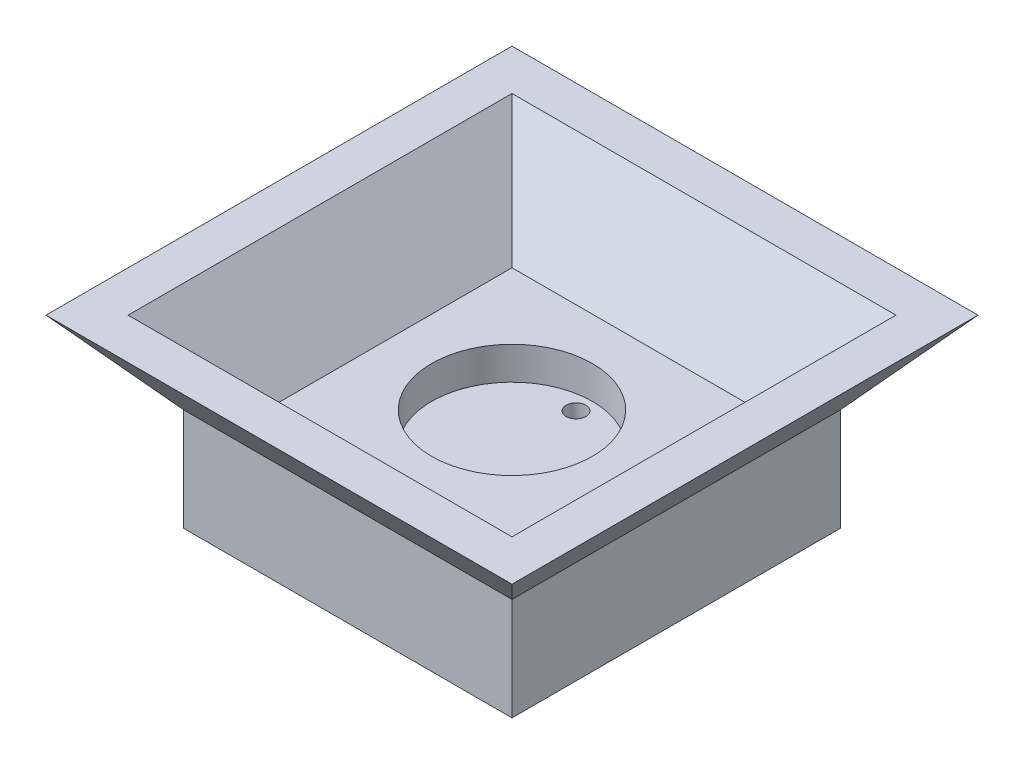
from build123d import *

# Parameters (mm, degrees)
SKETCH1_W               = 50.8
SKETCH1_H               = 50.8
BOSS_EXTRUDE1_DEPTH     = 15.875
SKETCH2_W               = 50.8
SKETCH2_H               = 50.8
BOSS_EXTRUDE2_DEPTH     = 12.7
BOSS_EXTRUDE2_DRAFT     = -40
MIRROR1_COPY_1_SKETCH_W = 50.8
MIRROR1_COPY_1_SKETCH_H = 50.8
MIRROR1_COPY_1_DEPTH    = 12.7
MIRROR1_COPY_1_DRAFT    = -40
SKETCH4_W               = 59.413130632
SKETCH4_H               = 59.413130632
CUT_EXTRUDE2_DEPTH      = 12.7
CUT_EXTRUDE2_DRAFT      = -40
SKETCH5_R               = 12.446
CUT_EXTRUDE3_DEPTH      = 5.08
SKETCH6_R               = 1.524
CUT_EXTRUDE4_DEPTH      = 20.32
CUT_EXTRUDE5_REACH      = 60.452
SKETCH8_W               = 110.353971767
SKETCH8_H               = 106.914185114


with BuildPart() as part:
    # Sketch1 → Boss-Extrude1 (new, symmetric)
    with BuildSketch(Plane(origin=(0, 0, 0), x_dir=(1, 0, 0), z_dir=(0, 1, 0))):
        Rectangle(SKETCH1_W, SKETCH1_H)
    extrude(amount=BOSS_EXTRUDE1_DEPTH, both=True)


with BuildPart() as boss_extrude2_tool:
    # Sketch2 → Boss-Extrude2 (with draft: the straight prism first)
    with BuildSketch(Plane(origin=(0, 15.875, 0), x_dir=(1, 0, 0), z_dir=(0, 1, 0))):
        Rectangle(SKETCH2_W, SKETCH2_H)
    extrude(amount=BOSS_EXTRUDE2_DEPTH)
    # Boss-Extrude2: the draft: its side faces are tilted about the plane it starts from
    boss_extrude2_sides = [boss_extrude2_tool.faces().sort_by_distance(p)[0] for p in [
        (-25.4, 22.225, 0),
        (0, 22.225, 25.4),
        (25.4, 22.225, 0),
        (0, 22.225, -25.4),
    ]]
    draft(boss_extrude2_sides, Plane(origin=(0, 15.875, 0), x_dir=(1, 0, 0), z_dir=(0, 1, 0)), BOSS_EXTRUDE2_DRAFT)


with BuildPart() as part_1:
    add(part.part)

    # Boss-Extrude2: add boss_extrude2_tool
    add(boss_extrude2_tool.part)


with BuildPart() as mirror1_copy_1_tool:
    # Mirror1 copy 1 sketch → Mirror1 copy 1 (with draft: the straight prism first)
    with BuildSketch(Plane.XZ.offset(15.875)):
        Rectangle(MIRROR1_COPY_1_SKETCH_W, MIRROR1_COPY_1_SKETCH_H)
    extrude(amount=MIRROR1_COPY_1_DEPTH)
    # Mirror1 copy 1: the draft: its side faces are tilted about the plane it starts from
    mirror1_copy_1_sides = [mirror1_copy_1_tool.faces().sort_by_distance(p)[0] for p in [
        (-25.4, -22.225, 0),
        (0, -22.225, 25.4),
        (25.4, -22.225, 0),
        (0, -22.225, -25.4),
    ]]
    draft(mirror1_copy_1_sides, Plane.XZ.offset(15.875), MIRROR1_COPY_1_DRAFT)


with BuildPart() as part_2:
    add(part_1.part)

    # Mirror1 copy 1: add mirror1_copy_1_tool
    add(mirror1_copy_1_tool.part)


with BuildPart() as cut_extrude2_tool:
    # Sketch4 → Cut-Extrude2 (with draft: the straight prism first)
    with BuildSketch(Plane(origin=(0, 28.575, 0), x_dir=(1, 0, 0), z_dir=(0, 1, 0))):
        Rectangle(SKETCH4_W, SKETCH4_H)
    extrude(amount=-CUT_EXTRUDE2_DEPTH)
    # Cut-Extrude2: the draft: its side faces are tilted about the plane it starts from
    cut_extrude2_sides = [cut_extrude2_tool.faces().sort_by_distance(p)[0] for p in [
        (29.706565316, 22.225, 0),
        (0, 22.225, -29.706565316),
        (-29.706565316, 22.225, 0),
        (0, 22.225, 29.706565316),
    ]]
    draft(cut_extrude2_sides, Plane(origin=(0, 28.575, 0), x_dir=(1, 0, 0), z_dir=(0, 1, 0)), CUT_EXTRUDE2_DRAFT)


with BuildPart() as part_3:
    add(part_2.part)

    # Cut-Extrude2: cut by cut_extrude2_tool
    add(cut_extrude2_tool.part, mode=Mode.SUBTRACT)

    # Sketch5 → Cut-Extrude3 (cut)
    with BuildSketch(Plane(origin=(0, 15.875, 0), x_dir=(1, 0, 0), z_dir=(0, 1, 0))):
        Circle(SKETCH5_R)
    extrude(amount=-CUT_EXTRUDE3_DEPTH, mode=Mode.SUBTRACT)

    # Sketch6 → Cut-Extrude4 (cut)
    with BuildSketch(Plane(origin=(0, 10.795, 0), x_dir=(1, 0, 0), z_dir=(0, 1, 0))):
        with Locations((0, 9.906)):
            Circle(SKETCH6_R)
    extrude(amount=-CUT_EXTRUDE4_DEPTH, mode=Mode.SUBTRACT)

    # Sketch8 → Cut-Extrude5 (cut, up to next)
    with BuildSketch(Plane(origin=(0, 0, 0), x_dir=(1, 0, 0), z_dir=(0, 1, 0)), mode=Mode.PRIVATE) as cut_extrude5_sk1:
        with Locations((3.158987741, -3.05368815)):
            Rectangle(SKETCH8_W, SKETCH8_H)
    cut_extrude5_tool1 = extrude(cut_extrude5_sk1.sketch, amount=-CUT_EXTRUDE5_REACH, mode=Mode.PRIVATE) & part_3.part
    add(cut_extrude5_tool1.solids().sort_by_distance((3.158988, 0, 3.053688))[0], mode=Mode.SUBTRACT)


solid = part_3.part
